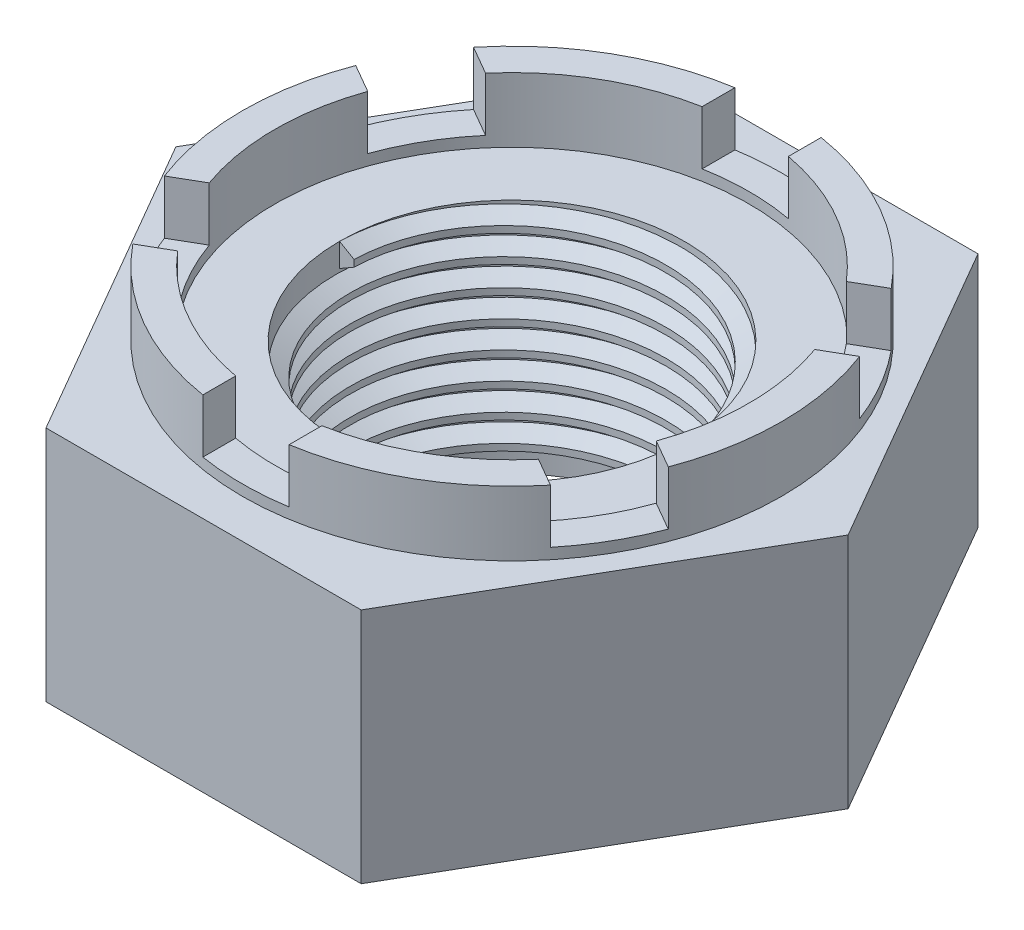
from build123d import *

# Parameters (mm, degrees)
SKETCH2_R           = 8
BOSS_EXTRUDE1_DEPTH = 11
THREAD2_PITCH       = 1.25
SKETCH11_R          = 12.5
SKETCH11_R_2        = 11
BOSS_EXTRUDE2_DEPTH = 3
SKETCH12_W          = 4
SKETCH12_H          = 2.322021401
CUT_EXTRUDE1_DEPTH  = 2.5
CIRPATTERN1_COUNT   = 6


with BuildPart() as part:
    # Sketch2 → Boss-Extrude1 (new body)
    with BuildSketch(Plane(origin=(0, 0, 0), x_dir=(1, 0, 0), z_dir=(0, 1, 0))):
        Polygon((-7.309560465, 14.304199751), (7.309560465, 14.304199751), (15.59, 0), (7.309560465, -14.304199751), (-7.309560465, -14.304199751), (-15.59, 0), align=None)
        with Locations(Location((0, 0, 0), (0, 0, 270))):
            Circle(SKETCH2_R, mode=Mode.SUBTRACT)
    extrude(amount=BOSS_EXTRUDE1_DEPTH)

    # Thread2: the profile of Thread Profile3 profile screwed along a right-hand helix of 8 turns, 8 arcs to a turn; built about Z, then put on its axis
    thread2_z = Axis((0, 0, 0), (0, 0, 1))
    thread2_corners = [(8.0003, 0, -0.000173205), (8.0003, 0, 1.093923202), (7.323417656, 0, 0.703124998), (7.323417656, 0, 0.390624998)]
    with BuildLine(mode=Mode.PRIVATE) as thread2_profile:
        Line(thread2_corners[0], thread2_corners[1])
        Line(thread2_corners[1], thread2_corners[2])
        Line(thread2_corners[2], thread2_corners[3])
        Line(thread2_corners[3], thread2_corners[0])
    thread2_cap = Face(thread2_profile.wire())
    thread2_turn_angles = [0, 22.5, 45, 67.5, 90, 112.5, 135, 157.5, 180, 202.5, 225, 247.5, 270, 292.5, 315, 337.5, 360]
    thread2_turn_weights = [1, 0.9238795325112867, 1, 0.9238795325112867, 1, 0.9238795325112867, 1, 0.9238795325112867, 1, 0.9238795325112867, 1, 0.9238795325112867, 1, 0.9238795325112867, 1, 0.9238795325112867, 1]
    thread2_turn_rails = [Edge.make_bspline([Vector(p[0], p[1], 0).rotate(thread2_z, thread2_turn_angles[k]) / thread2_turn_weights[k] + Vector(0, 0, p[2] + THREAD2_PITCH * thread2_turn_angles[k] / 360) for k in range(17)], [0, 0, 0, 1, 1, 2, 2, 3, 3, 4, 4, 5, 5, 6, 6, 7, 7, 8, 8, 8], 2, thread2_turn_weights) for p in thread2_corners]
    thread2_turn_sides = [Face.make_surface_from_curves(thread2_turn_rails[p[0]], thread2_turn_rails[p[1]]) for p in [(0, 1), (1, 2), (2, 3), (3, 0)]]
    thread2 = Plane(origin=(0, 11, 0), x_dir=(-1, 0, 0), z_dir=(0, -1, 0)) * Solid(Shell([*[p.moved(Location((0, 0, THREAD2_PITCH * i))) for i in range(8) for p in thread2_turn_sides], thread2_cap, thread2_cap.rotate(thread2_z, 2880).moved(Location((0, 0, THREAD2_PITCH * 2880 / 360)))]))
    add(thread2)

    # Sketch11 → Boss-Extrude2 (add)
    with BuildSketch(Plane(origin=(0, 11, 0), x_dir=(1, 0, 0), z_dir=(0, 1, 0))):
        with Locations(Location((0, 0, 0), (0, 0, 90))):
            Circle(SKETCH11_R)
        with Locations(Location((0, 0, 0), (0, 0, 270))):
            Circle(SKETCH11_R_2, mode=Mode.SUBTRACT)
    extrude(amount=BOSS_EXTRUDE2_DEPTH)

    # Sketch12 → Cut-Extrude1 (cut)
    with BuildSketch(Plane(origin=(0, 14, 0), x_dir=(1, 0, 0), z_dir=(0, 1, 0))):
        with Locations((0, 11.72454998)):
            Rectangle(SKETCH12_W, SKETCH12_H)
    cut_extrude1 = extrude(amount=-CUT_EXTRUDE1_DEPTH, mode=Mode.SUBTRACT)

    # CirPattern1: Cut-Extrude1 ×6 about axis
    cirpattern1_axis = Axis((0, 0, 0), (0, 1, 0))
    for i in range(1, CIRPATTERN1_COUNT):
        add(cut_extrude1.rotate(cirpattern1_axis, i * 360 / CIRPATTERN1_COUNT), mode=Mode.SUBTRACT)


solid = part.part
